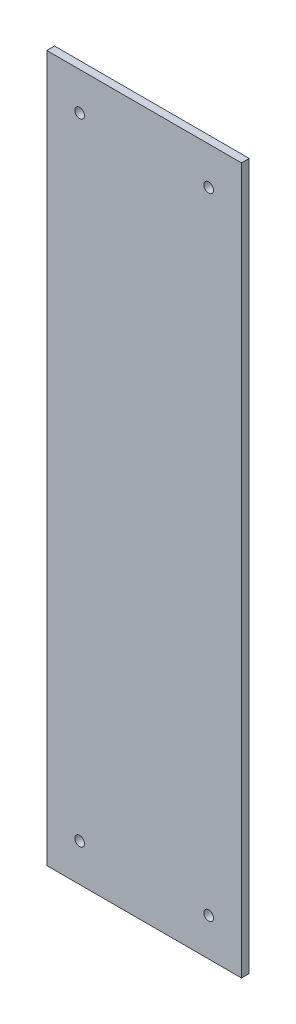
from build123d import *

# Parameters (mm, degrees)
SKETCH1_W           = 80
SKETCH1_H           = 290
SKETCH1_R           = 2
BOSS_EXTRUDE1_DEPTH = 1.5875


with BuildPart() as part:
    # Sketch1 → Boss-Extrude1 (new, symmetric)
    with BuildSketch(Plane.XY):
        Rectangle(SKETCH1_W, SKETCH1_H)
        with Locations((-26.5, -129.5)):
            Circle(SKETCH1_R, mode=Mode.SUBTRACT)
        with Locations((26.5, -129.5)):
            Circle(SKETCH1_R, mode=Mode.SUBTRACT)
        with Locations((-26.5, 129.5)):
            Circle(SKETCH1_R, mode=Mode.SUBTRACT)
        with Locations((26.5, 129.5)):
            Circle(SKETCH1_R, mode=Mode.SUBTRACT)
    extrude(amount=BOSS_EXTRUDE1_DEPTH, both=True)


solid = part.part
